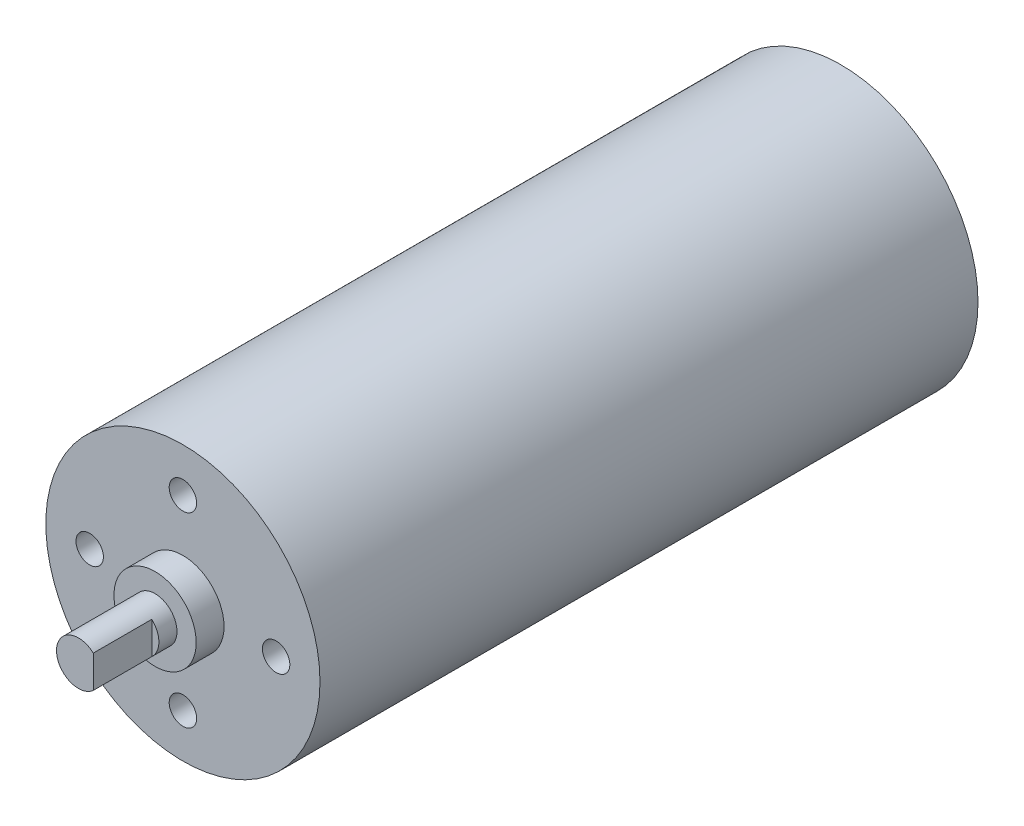
from build123d import *

# Parameters (mm, degrees)
SKETCH1_R                       = 12.5
BOSS_EXTRUDE1_DEPTH             = 60
SKETCH4_R                       = 2
BOSS_EXTRUDE3_DEPTH             = 9.525
SKETCH5_R                       = 3.75
BOSS_EXTRUDE4_DEPTH             = 2.54
CUT_EXTRUDE2_START              = -5.334
CUT_EXTRUDE2_DEPTH              = 5.334
TAP_DRILL_FOR_M3X0_5_TAP1_D     = 2.5
TAP_DRILL_FOR_M3X0_5_TAP1_DEPTH = 10.0000054
TAP_DRILL_FOR_M3X0_5_TAP1_TIP   = 0.751075774


with BuildPart() as part:
    # Sketch1 → Boss-Extrude1 (new body)
    with BuildSketch(Plane.XY):
        Circle(SKETCH1_R)
    extrude(amount=-BOSS_EXTRUDE1_DEPTH)

    # Sketch4 → Boss-Extrude3 (add)
    with BuildSketch(Plane.XY):
        Circle(SKETCH4_R)
    extrude(amount=BOSS_EXTRUDE3_DEPTH)

    # Sketch5 → Boss-Extrude4 (add)
    with BuildSketch(Plane.XY):
        Circle(SKETCH5_R)
    extrude(amount=BOSS_EXTRUDE4_DEPTH)

    # Sketch6 → Cut-Extrude2 (cut)
    with BuildSketch(Plane.XY.offset(9.525).offset(CUT_EXTRUDE2_START)):
        with BuildLine():
            Line((1.35278764, 1.473080311), (1.35278764, -1.473080311))
            ThreePointArc((1.35278764, -1.473080311), (2, 0), (1.35278764, 1.473080311))
        make_face()
    extrude(amount=CUT_EXTRUDE2_DEPTH, mode=Mode.SUBTRACT)

    # Tap Drill for M3x0.5 Tap1
    with Locations(Plane.XY):
        with Locations((0, 8.5), (8.5, 0), (0, -8.5), (-8.5, 0)):
            Hole(TAP_DRILL_FOR_M3X0_5_TAP1_D / 2, depth=TAP_DRILL_FOR_M3X0_5_TAP1_DEPTH)
            with Locations((0, 0, -(TAP_DRILL_FOR_M3X0_5_TAP1_DEPTH + TAP_DRILL_FOR_M3X0_5_TAP1_TIP / 2))):  # 118° drill point
                Cone(0, TAP_DRILL_FOR_M3X0_5_TAP1_D / 2, TAP_DRILL_FOR_M3X0_5_TAP1_TIP, mode=Mode.SUBTRACT)


solid = part.part
